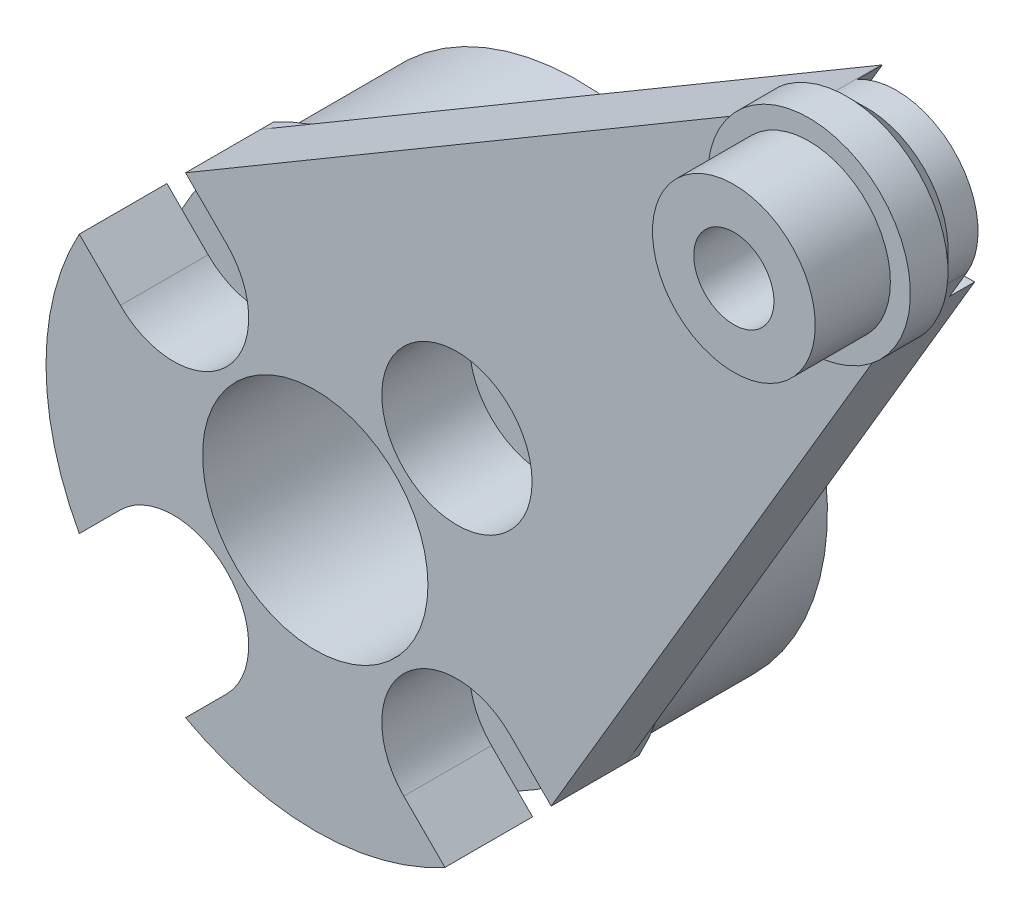
from build123d import *
from build123d.topology import SkipClean

# Parameters (mm, degrees)
SKETCH1_R           = 9.95
SKETCH1_R_2         = 4.5
SKETCH1_R_3         = 1.6
BOSS_EXTRUDE1_DEPTH = 7
BOSS_EXTRUDE3_START = 0.5
SKETCH3_R           = 4.5
BOSS_EXTRUDE3_DEPTH = 0.5
BOSS_EXTRUDE4_START = 3
SKETCH5_R           = 3
SKETCH5_R_2         = 4.5
BOSS_EXTRUDE4_DEPTH = 3
SKETCH6_R           = 4.05
BOSS_EXTRUDE5_DEPTH = 1.5
BOSS_EXTRUDE6_START = 3
SKETCH7_R           = 3.25
BOSS_EXTRUDE6_DEPTH = 3
CHAMFER1_SIZE       = 0.8
CUT_EXTRUDE1_START  = -1
CUT_EXTRUDE1_DEPTH  = 1
SKETCH9_R           = 1.6
CUT_EXTRUDE2_DEPTH  = 37.724772234
BOSS_EXTRUDE7_DEPTH = 2
CUT_EXTRUDE3_DEPTH  = 2
CUT_EXTRUDE3_DRAFT  = -5


with BuildPart() as part:
    # Sketch1 → Boss-Extrude1 (new body)
    with BuildSketch(Plane.XY):
        Circle(SKETCH1_R)
        Circle(SKETCH1_R_2, mode=Mode.SUBTRACT)
        with Locations((-5.656854249, -5.656854249)):
            Circle(SKETCH1_R_3, mode=Mode.SUBTRACT)
        with Locations((-5.656854249, 5.656854249)):
            Circle(SKETCH1_R_3, mode=Mode.SUBTRACT)
        with Locations((5.656854249, 5.656854249)):
            Circle(SKETCH1_R_3, mode=Mode.SUBTRACT)
        with Locations((5.656854249, -5.656854249)):
            Circle(SKETCH1_R_3, mode=Mode.SUBTRACT)
    extrude(amount=-BOSS_EXTRUDE1_DEPTH)

    # Sketch3 → Boss-Extrude3 (add)
    # profile 1 of 5: a face of its own
    with BuildSketch(Plane.XY.offset(BOSS_EXTRUDE3_START)):
        with BuildLine():
            ThreePointArc((4.586976758, 8.829617445), (0, 9.95), (-4.586976758, 8.829617445))
            Line((-4.586976758, 8.829617445), (-3.535533906, 7.778174593))
            ThreePointArc((-3.535533906, 7.778174593), (-3.535533906, 3.535533906), (-7.778174593, 3.535533906))
            Line((-7.778174593, 3.535533906), (-8.829617445, 4.586976758))
            ThreePointArc((-8.829617445, 4.586976758), (-9.95, 0), (-8.829617445, -4.586976758))
            Line((-8.829617445, -4.586976758), (-7.778174593, -3.535533906))
            ThreePointArc((-7.778174593, -3.535533906), (-3.535533906, -3.535533906), (-3.535533906, -7.778174593))
            Line((-3.535533906, -7.778174593), (-4.586976758, -8.829617445))
            ThreePointArc((-4.586976758, -8.829617445), (0, -9.95), (4.586976758, -8.829617445))
            Line((4.586976758, -8.829617445), (3.535533906, -7.778174593))
            ThreePointArc((3.535533906, -7.778174593), (3.535533906, -3.535533906), (7.778174593, -3.535533906))
            Line((7.778174593, -3.535533906), (8.829617445, -4.586976758))
            ThreePointArc((8.829617445, -4.586976758), (9.665846926, -2.360911521), (9.95, 0))
            ThreePointArc((9.95, 0), (9.665846926, 2.360911521), (8.829617445, 4.586976758))
            Line((8.829617445, 4.586976758), (7.778174593, 3.535533906))
            ThreePointArc((7.778174593, 3.535533906), (3.535533906, 3.535533906), (3.535533906, 7.778174593))
            Line((3.535533906, 7.778174593), (4.586976758, 8.829617445))
        make_face()
        Circle(SKETCH3_R, mode=Mode.SUBTRACT)
    # profile 2 of 5: a face of its own
    with BuildSketch(Plane.XY.offset(BOSS_EXTRUDE3_START)):
        with BuildLine():
            Line((-8.829617445, 4.586976758), (-9.420721004, 5.178080317))
            ThreePointArc((-9.420721004, 5.178080317), (-10.75, 0), (-9.420721004, -5.178080317))
            Line((-9.420721004, -5.178080317), (-8.829617445, -4.586976758))
            ThreePointArc((-8.829617445, -4.586976758), (-9.95, 0), (-8.829617445, 4.586976758))
        make_face()
    # profile 3 of 5: a face of its own
    with BuildSketch(Plane.XY.offset(BOSS_EXTRUDE3_START)):
        with BuildLine():
            ThreePointArc((5.178080317, 9.420721004), (0, 10.75), (-5.178080317, 9.420721004))
            Line((-5.178080317, 9.420721004), (-4.586976758, 8.829617445))
            ThreePointArc((-4.586976758, 8.829617445), (0, 9.95), (4.586976758, 8.829617445))
            Line((4.586976758, 8.829617445), (5.178080317, 9.420721004))
        make_face()
    # profile 4 of 5: a face of its own
    with BuildSketch(Plane.XY.offset(BOSS_EXTRUDE3_START)):
        with BuildLine():
            ThreePointArc((10.75, 0), (10.41237847, 2.672989825), (9.420721004, 5.178080317))
            Line((9.420721004, 5.178080317), (8.829617445, 4.586976758))
            ThreePointArc((8.829617445, 4.586976758), (9.665846926, 2.360911521), (9.95, 0))
            ThreePointArc((9.95, 0), (9.665846926, -2.360911521), (8.829617445, -4.586976758))
            Line((8.829617445, -4.586976758), (9.420721004, -5.178080317))
            ThreePointArc((9.420721004, -5.178080317), (10.41237847, -2.672989825), (10.75, 0))
        make_face()
    # profile 5 of 5: a face of its own
    with BuildSketch(Plane.XY.offset(BOSS_EXTRUDE3_START)):
        with BuildLine():
            Line((-4.586976758, -8.829617445), (-5.178080317, -9.420721004))
            ThreePointArc((-5.178080317, -9.420721004), (0, -10.75), (5.178080317, -9.420721004))
            Line((5.178080317, -9.420721004), (4.586976758, -8.829617445))
            ThreePointArc((4.586976758, -8.829617445), (0, -9.95), (-4.586976758, -8.829617445))
        make_face()
    extrude(amount=-BOSS_EXTRUDE3_DEPTH)

    # Sketch5 → Boss-Extrude4 (add)
    with SkipClean():  # the faces are left unmerged after this step: merging them gives an invalid solid
        with BuildSketch(Plane.XY.offset(0.5).offset(BOSS_EXTRUDE4_START)):
            with BuildLine():
                Line((-5.178080317, 9.420721004), (19.562128784, 24.012569881))
                ThreePointArc((19.562128784, 24.012569881), (23.511300474, 23.511300474), (24.012569881, 19.562128784))
                Line((24.012569881, 19.562128784), (9.420721004, -5.178080317))
                Line((9.420721004, -5.178080317), (7.778174593, -3.535533906))
                ThreePointArc((7.778174593, -3.535533906), (3.535533906, -3.535533906), (3.535533906, -7.778174593))
                Line((3.535533906, -7.778174593), (5.178080317, -9.420721004))
                ThreePointArc((5.178080317, -9.420721004), (0, -10.75), (-5.178080317, -9.420721004))
                Line((-5.178080317, -9.420721004), (-3.535533906, -7.778174593))
                ThreePointArc((-3.535533906, -7.778174593), (-3.535533906, -3.535533906), (-7.778174593, -3.535533906))
                Line((-7.778174593, -3.535533906), (-9.420721004, -5.178080317))
                ThreePointArc((-9.420721004, -5.178080317), (-10.75, 0), (-9.420721004, 5.178080317))
                Line((-9.420721004, 5.178080317), (-7.778174593, 3.535533906))
                ThreePointArc((-7.778174593, 3.535533906), (-3.535533906, 3.535533906), (-3.535533906, 7.778174593))
                Line((-3.535533906, 7.778174593), (-5.178080317, 9.420721004))
            make_face()
            with Locations(Location((5.656854249, 5.656854249, 0), (0, 0, 135))):
                Circle(SKETCH5_R, mode=Mode.SUBTRACT)
            Circle(SKETCH5_R_2, mode=Mode.SUBTRACT)
        extrude(amount=-BOSS_EXTRUDE4_DEPTH)

    # Sketch6 → Boss-Extrude5 (add)
    with SkipClean():  # the faces are left unmerged after this step: merging them gives an invalid solid
        with BuildSketch(Plane(origin=(0, 0, 3.5), x_dir=(-1, 0, 0), z_dir=(0, 0, -1))):
            with Locations((-21.213203436, 21.213203436)):
                Circle(SKETCH6_R)
        extrude(amount=-BOSS_EXTRUDE5_DEPTH)

    # Sketch7 → Boss-Extrude6 (add)
    with SkipClean():  # the faces are left unmerged after this step: merging them gives an invalid solid
        with BuildSketch(Plane.XY.offset(5).offset(BOSS_EXTRUDE6_START)):
            with Locations((21.213203436, 21.213203436)):
                Circle(SKETCH7_R)
        extrude(amount=-BOSS_EXTRUDE6_DEPTH)

    # Chamfer1
    # the kernel refuses this chamfer: 0.8 mm, written as the material it adds along each edge
    with BuildSketch(Plane(origin=(24.012569881, 19.562128784, 3.5), x_dir=(-0.02368339518990366, 0.013968536890575577, -0.9996219169112968), z_dir=(-0.5080229697131419, -0.8613435216241195, 0))) as chamfer1_piece_1_section:
        Polygon((CHAMFER1_SIZE * 0.999621916911, CHAMFER1_SIZE * 0.0274958766106), (-CHAMFER1_SIZE * 0.0274958766106, CHAMFER1_SIZE * 0.999621916911), (0, 0), align=None)
    chamfer1_piece_1 = extrude(amount=4.473955585, mode=Mode.PRIVATE)
    chamfer1_piece_1 = chamfer1_piece_1 & Plane(origin=(21.213203436, 21.213203436, 3.215245779), x_dir=(-1, 0, 0), z_dir=(0, 0, -1)) * Cylinder(4.05, 13, mode=Mode.PRIVATE)
    add(chamfer1_piece_1)
    with BuildSketch(Plane(origin=(21.213203436, 21.213203436, 3.5), x_dir=(-0.508022969713124, 0.8613435216241301, 0), z_dir=(-0.8613435216241301, -0.508022969713124, 0))) as chamfer1_piece_2:
        Polygon((3.25, CHAMFER1_SIZE), (3.25 + CHAMFER1_SIZE, 0), (3.25, 0), align=None)
    revolve(axis=Axis((21.213203436, 21.213203436, 3.5), (0, 0, -1)), revolution_arc=151.064460502)
    with BuildSketch(Plane(origin=(15.708516125, 21.739697678, 3.5), x_dir=(0.01396853689057517, -0.0236833951899039, -0.9996219169112968), z_dir=(0.8613435216241283, 0.508022969713127, 0))) as chamfer1_piece_3_section:
        Polygon((CHAMFER1_SIZE * 0.999621916911, CHAMFER1_SIZE * 0.0274958766106), (-CHAMFER1_SIZE * 0.0274958766106, CHAMFER1_SIZE * 0.999621916911), (0, 0), align=None)
    chamfer1_piece_3 = extrude(amount=4.473955585, mode=Mode.PRIVATE)
    chamfer1_piece_3 = chamfer1_piece_3 & Plane(origin=(21.213203436, 21.213203436, 3.215245779), x_dir=(-1, 0, 0), z_dir=(0, 0, -1)) * Cylinder(4.05, 13, mode=Mode.PRIVATE)
    add(chamfer1_piece_3)

    # Sketch8 → Cut-Extrude1 (cut)
    with BuildSketch(Plane(origin=(0, 0, 0.5), x_dir=(-1, 0, 0), z_dir=(0, 0, -1)).offset(CUT_EXTRUDE1_START)):
        with BuildLine():
            Line((-22.803705141, 18.398307761), (-19.570683125, 18.428340717))
            Line((-19.570683125, 18.428340717), (-17.98018142, 21.243236391))
            Line((-17.98018142, 21.243236391), (-19.62270173, 24.02809911))
            Line((-19.62270173, 24.02809911), (-19.639679475, 24.056884561))
            ThreePointArc((-19.639679475, 24.056884561), (-23.542662563, 23.479504425), (-24.012569881, 19.562128784))
            Line((-24.012569881, 19.562128784), (-23.326144782, 18.398307761))
            Line((-23.326144782, 18.398307761), (-22.803705141, 18.398307761))
        make_face()
    extrude(amount=CUT_EXTRUDE1_DEPTH, mode=Mode.SUBTRACT)

    # Sketch9 → Cut-Extrude2 (cut, through all)
    with BuildSketch(Plane(origin=(0, 0, 1.5), x_dir=(-1, 0, 0), z_dir=(0, 0, -1))):
        with Locations((-21.213203436, 21.213203436)):
            Circle(SKETCH9_R)
    extrude(amount=-CUT_EXTRUDE2_DEPTH, mode=Mode.SUBTRACT)

    # Sketch10 → Boss-Extrude7 (add)
    with BuildSketch(Plane(origin=(0, 0, -7), x_dir=(-1, 0, 0), z_dir=(0, 0, -1))):
        with BuildLine():
            ThreePointArc((9.610301508, 2.577713121), (7.35, 0), (9.610301508, -2.577713121))
            ThreePointArc((9.610301508, -2.577713121), (9.95, 0), (9.610301508, 2.577713121))
        make_face()
    extrude(amount=BOSS_EXTRUDE7_DEPTH)


with BuildPart() as cut_extrude3_tool:
    # Sketch11 → Cut-Extrude3 (with draft: the straight prism first)
    with BuildSketch(Plane(origin=(0, 0, -7), x_dir=(-1, 0, 0), z_dir=(0, 0, -1))):
        with BuildLine():
            ThreePointArc((-2.26467179, -4.332286617), (-3.630697194, -3.966261214), (-3.996722598, -5.332286617))
            Line((-3.996722598, -5.332286617), (-3.246722598, -6.631324723))
            ThreePointArc((-3.246722598, -6.631324723), (-1.880697194, -6.997350127), (-1.51467179, -5.631324723))
            Line((-1.51467179, -5.631324723), (-2.26467179, -4.332286617))
        make_face()
    extrude(amount=-CUT_EXTRUDE3_DEPTH)
    # Cut-Extrude3: the draft: its side faces are tilted about the plane it starts from
    cut_extrude3_sides = [cut_extrude3_tool.faces().sort_by_distance(p)[0] for p in [
        (1.880697194, -6.997350127, -6),
        (1.88967179, -4.98180567, -6),
        (3.630697194, -3.966261214, -6),
        (3.621722598, -5.98180567, -6),
    ]]
    draft(cut_extrude3_sides, Plane(origin=(0, 0, -7), x_dir=(-1, 0, 0), z_dir=(0, 0, -1)), CUT_EXTRUDE3_DRAFT)


with BuildPart() as part_1:
    add(part.part)

    # Cut-Extrude3: cut by cut_extrude3_tool
    add(cut_extrude3_tool.part, mode=Mode.SUBTRACT)


solid = part_1.part
